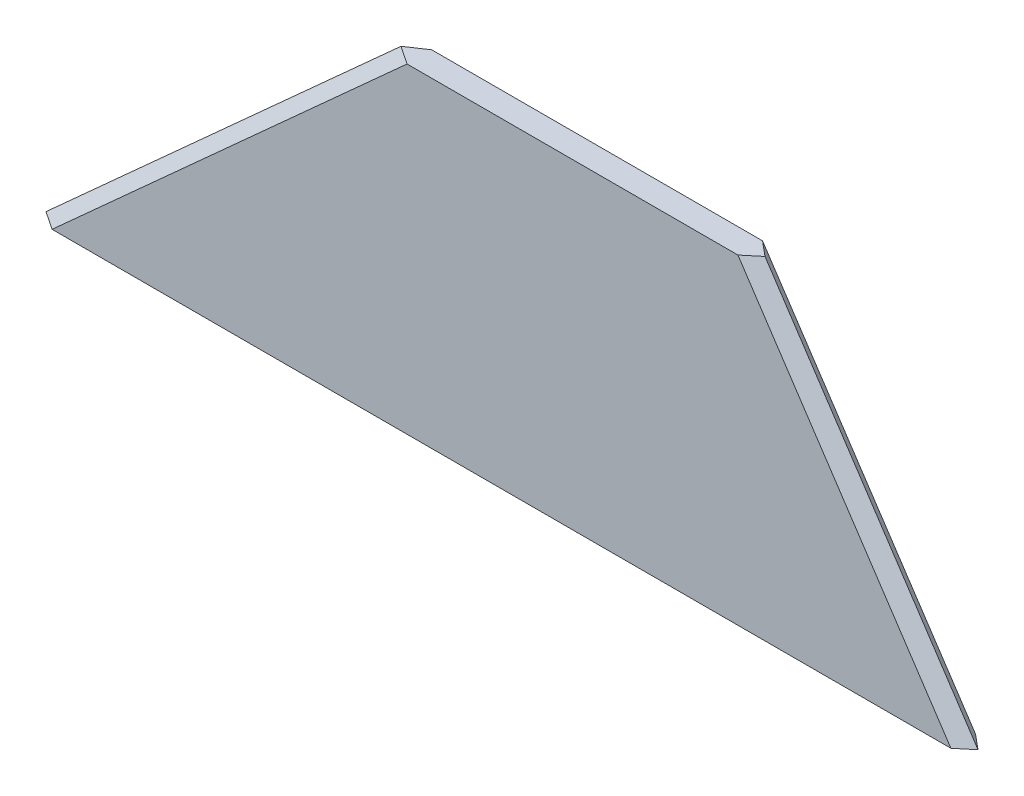
from build123d import *

# Parameters (mm, degrees)
BOSS_EXTRUDE1_DEPTH = 5.2832
CHAMFER1_SIZE       = 3.81


with BuildPart() as part:
    # Sketch1 → Boss-Extrude1 (new body)
    with BuildSketch(Plane.XY):
        Polygon((0, 0), (203.2, 0), (157.48, 68.834), (76.2, 68.834), align=None)
    extrude(amount=BOSS_EXTRUDE1_DEPTH)

    # Chamfer1
    # the kernel refuses this chamfer: 3.81 mm, written as the material it takes off along each edge
    with BuildSketch(Plane(origin=(208.621106578, -8.161777125, 5.2832), x_dir=(0.022903923995424024, 0.015212938447145094, -0.9996219169112966), z_dir=(-0.5532807214186398, 0.8329948639136195, 0))) as chamfer1_piece_1:
        Polygon((CHAMFER1_SIZE * 0.999621916911, CHAMFER1_SIZE * 0.0274958766106), (-CHAMFER1_SIZE * 0.0274958766106, CHAMFER1_SIZE * 0.999621916911), (0, 0), align=None)
    extrude(amount=102.230587414, mode=Mode.SUBTRACT)
    with BuildSketch(Plane(origin=(208.621106578, -8.161777125, 0), x_dir=(0.022903923995424024, 0.015212938447145094, 0.9996219169112966), z_dir=(-0.5532807214186398, 0.8329948639136195, 0))) as chamfer1_piece_2:
        Polygon((CHAMFER1_SIZE * 0.999621916911, -CHAMFER1_SIZE * 0.0274958766106), (-CHAMFER1_SIZE * 0.0274958766106, -CHAMFER1_SIZE * 0.999621916911), (0, 0), align=None)
    extrude(amount=102.230587414, mode=Mode.SUBTRACT)
    with BuildSketch(Plane(origin=(83.470816045, 75.401970494, 5.2832), x_dir=(-0.01843131645089907, 0.020403671347858754, -0.9996219169112968), z_dir=(-0.7420629513591385, -0.6703301993944216, 0))) as chamfer1_piece_3:
        Polygon((CHAMFER1_SIZE * 0.999621916911, CHAMFER1_SIZE * 0.0274958766106), (-CHAMFER1_SIZE * 0.0274958766106, CHAMFER1_SIZE * 0.999621916911), (0, 0), align=None)
    extrude(amount=122.282930207, mode=Mode.SUBTRACT)
    with BuildSketch(Plane(origin=(83.470816045, 75.401970494, 0), x_dir=(-0.01843131645089907, 0.020403671347858754, 0.9996219169112968), z_dir=(-0.7420629513591385, -0.6703301993944216, 0))) as chamfer1_piece_4:
        Polygon((CHAMFER1_SIZE * 0.999621916911, -CHAMFER1_SIZE * 0.0274958766106), (-CHAMFER1_SIZE * 0.0274958766106, -CHAMFER1_SIZE * 0.999621916911), (0, 0), align=None)
    extrude(amount=122.282930207, mode=Mode.SUBTRACT)


solid = part.part
